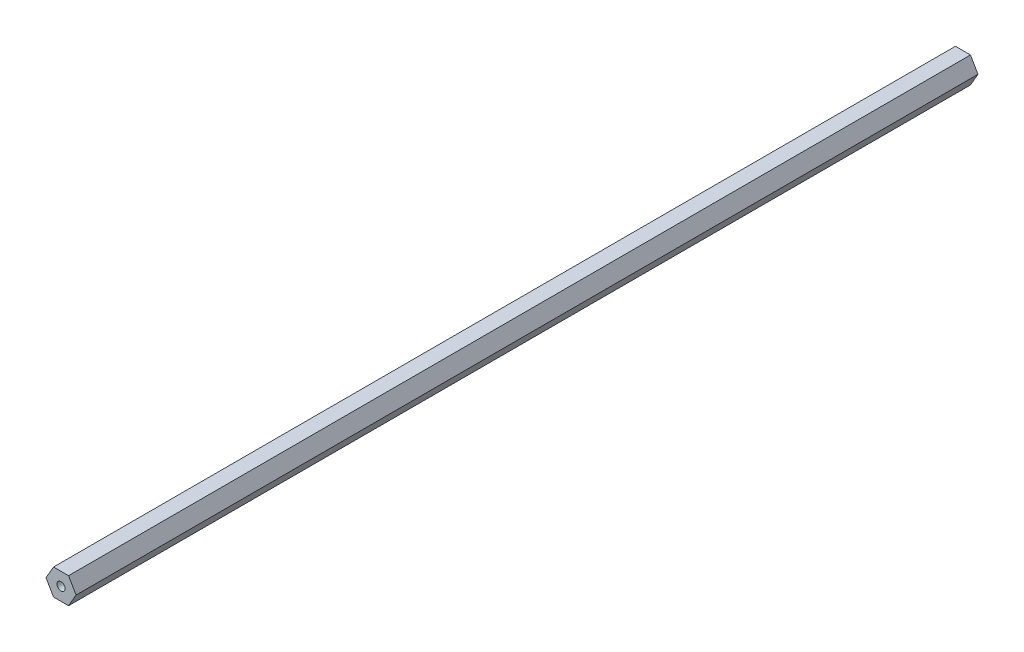
from build123d import *

# Parameters (mm, degrees)
SKETCH1_R           = 1.7145
BOSS_EXTRUDE1_DEPTH = 190.5


with BuildPart() as part:
    # Sketch1 → Boss-Extrude1 (new, symmetric)
    with BuildSketch(Plane.XY):
        Polygon((6.35, 0), (3.175, 5.499261314), (-3.175, 5.499261314), (-6.35, 0), (-3.175, -5.499261314), (3.175, -5.499261314), align=None)
        Circle(SKETCH1_R, mode=Mode.SUBTRACT)
    extrude(amount=BOSS_EXTRUDE1_DEPTH, both=True)


solid = part.part
